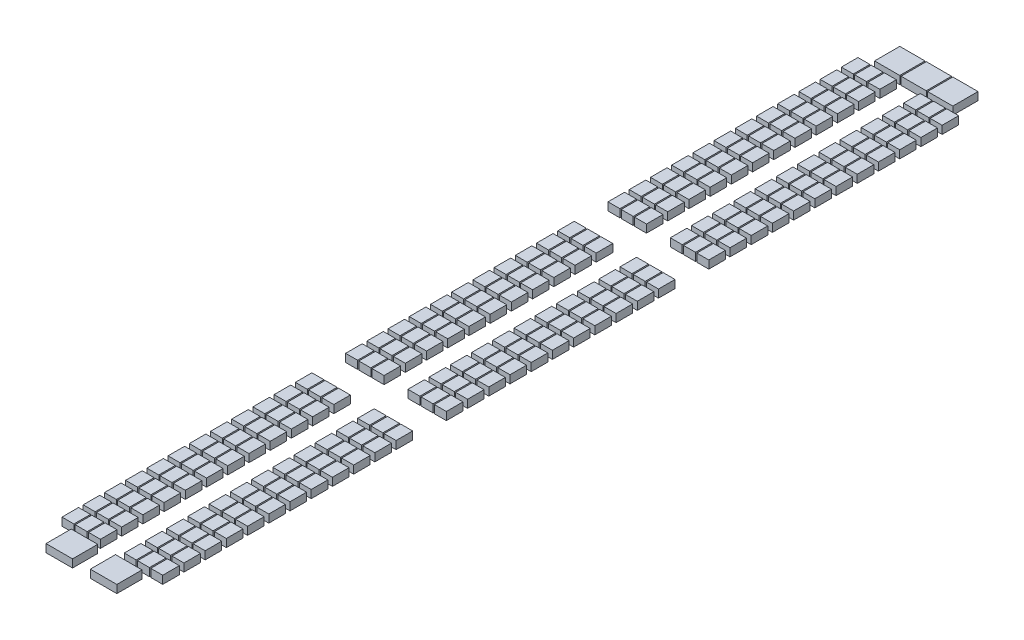
from build123d import *

# Parameters (mm, degrees)
SKETCH1_W           = 457.2
SKETCH1_H           = 635
SKETCH1_W_2         = 1016
SKETCH1_H_2         = 965.2
SKETCH1_W_3         = 965.2
BOSS_EXTRUDE1_DEPTH = 304.8


with BuildPart() as part:
    # Sketch1 → Boss-Extrude1 (new body)
    with BuildSketch(Plane(origin=(0, 0, 0), x_dir=(1, 0, 0), z_dir=(0, 1, 0))):
        with Locations((-1193.292, -14930.966666667)):
            Rectangle(SKETCH1_W, SKETCH1_H)
        with Locations((-1701.292, -14930.966666667)):
            Rectangle(SKETCH1_W, SKETCH1_H)
        with Locations((-685.292, -14930.966666667)):
            Rectangle(SKETCH1_W, SKETCH1_H)
        with Locations((-1193.292, -14118.166666667)):
            Rectangle(SKETCH1_W, SKETCH1_H)
        with Locations((-685.292, -14118.166666667)):
            Rectangle(SKETCH1_W, SKETCH1_H)
        with Locations((-1193.292, -13305.366666667)):
            Rectangle(SKETCH1_W, SKETCH1_H)
        with Locations((-685.292, -13305.366666667)):
            Rectangle(SKETCH1_W, SKETCH1_H)
        with Locations((-1701.292, -14118.166666667)):
            Rectangle(SKETCH1_W, SKETCH1_H)
        with Locations((-1701.292, -13305.366666667)):
            Rectangle(SKETCH1_W, SKETCH1_H)
        with Locations((-1701.292, -12492.566666667)):
            Rectangle(SKETCH1_W, SKETCH1_H)
        with Locations((-1193.292, -12492.566666667)):
            Rectangle(SKETCH1_W, SKETCH1_H)
        with Locations((-685.292, -12492.566666667)):
            Rectangle(SKETCH1_W, SKETCH1_H)
        with Locations((-1701.292, -11679.766666667)):
            Rectangle(SKETCH1_W, SKETCH1_H)
        with Locations((-1193.292, -11679.766666667)):
            Rectangle(SKETCH1_W, SKETCH1_H)
        with Locations((-685.292, -11679.766666667)):
            Rectangle(SKETCH1_W, SKETCH1_H)
        with Locations((-1701.292, -10866.966666667)):
            Rectangle(SKETCH1_W, SKETCH1_H)
        with Locations((-1193.292, -10866.966666667)):
            Rectangle(SKETCH1_W, SKETCH1_H)
        with Locations((-685.292, -10866.966666667)):
            Rectangle(SKETCH1_W, SKETCH1_H)
        with Locations((-1701.292, -10054.166666667)):
            Rectangle(SKETCH1_W, SKETCH1_H)
        with Locations((-1193.292, -10054.166666667)):
            Rectangle(SKETCH1_W, SKETCH1_H)
        with Locations((-685.292, -10054.166666667)):
            Rectangle(SKETCH1_W, SKETCH1_H)
        with Locations((-1701.292, -9241.366666667)):
            Rectangle(SKETCH1_W, SKETCH1_H)
        with Locations((-1193.292, -9241.366666667)):
            Rectangle(SKETCH1_W, SKETCH1_H)
        with Locations((-685.292, -9241.366666667)):
            Rectangle(SKETCH1_W, SKETCH1_H)
        with Locations((-1701.292, -8428.566666667)):
            Rectangle(SKETCH1_W, SKETCH1_H)
        with Locations((-1193.292, -8428.566666667)):
            Rectangle(SKETCH1_W, SKETCH1_H)
        with Locations((-685.292, -8428.566666667)):
            Rectangle(SKETCH1_W, SKETCH1_H)
        with Locations((-1701.292, -7615.766666667)):
            Rectangle(SKETCH1_W, SKETCH1_H)
        with Locations((-1193.292, -7615.766666667)):
            Rectangle(SKETCH1_W, SKETCH1_H)
        with Locations((-685.292, -7615.766666667)):
            Rectangle(SKETCH1_W, SKETCH1_H)
        with Locations((-1701.292, -6802.966666667)):
            Rectangle(SKETCH1_W, SKETCH1_H)
        with Locations((-1193.292, -6802.966666667)):
            Rectangle(SKETCH1_W, SKETCH1_H)
        with Locations((-685.292, -6802.966666667)):
            Rectangle(SKETCH1_W, SKETCH1_H)
        with Locations((-1701.292, -5990.166666667)):
            Rectangle(SKETCH1_W, SKETCH1_H)
        with Locations((-1193.292, -5990.166666667)):
            Rectangle(SKETCH1_W, SKETCH1_H)
        with Locations((-685.292, -5990.166666667)):
            Rectangle(SKETCH1_W, SKETCH1_H)
        with Locations((-1701.292, -4064)):
            Rectangle(SKETCH1_W, SKETCH1_H)
        with Locations((-1193.292, -4064)):
            Rectangle(SKETCH1_W, SKETCH1_H)
        with Locations((-685.292, -4064)):
            Rectangle(SKETCH1_W, SKETCH1_H)
        with Locations((-1193.292, -3251.2)):
            Rectangle(SKETCH1_W, SKETCH1_H)
        with Locations((-685.292, -3251.2)):
            Rectangle(SKETCH1_W, SKETCH1_H)
        with Locations((-1193.292, -2438.4)):
            Rectangle(SKETCH1_W, SKETCH1_H)
        with Locations((-685.292, -2438.4)):
            Rectangle(SKETCH1_W, SKETCH1_H)
        with Locations((-1193.292, -1625.6)):
            Rectangle(SKETCH1_W, SKETCH1_H)
        with Locations((-685.292, -1625.6)):
            Rectangle(SKETCH1_W, SKETCH1_H)
        with Locations((-1193.292, -812.8)):
            Rectangle(SKETCH1_W, SKETCH1_H)
        with Locations((-685.292, -812.8)):
            Rectangle(SKETCH1_W, SKETCH1_H)
        with Locations((-1701.292, -3251.2)):
            Rectangle(SKETCH1_W, SKETCH1_H)
        with Locations((-1701.292, -2438.4)):
            Rectangle(SKETCH1_W, SKETCH1_H)
        with Locations((-1701.292, -1625.6)):
            Rectangle(SKETCH1_W, SKETCH1_H)
        with Locations((-1701.292, -812.8)):
            Rectangle(SKETCH1_W, SKETCH1_H)
        with Locations((-1701.292, 0)):
            Rectangle(SKETCH1_W, SKETCH1_H)
        with Locations((-1193.292, 0)):
            Rectangle(SKETCH1_W, SKETCH1_H)
        with Locations((-685.292, 0)):
            Rectangle(SKETCH1_W, SKETCH1_H)
        with Locations((-1701.292, 812.8)):
            Rectangle(SKETCH1_W, SKETCH1_H)
        with Locations((-1193.292, 812.8)):
            Rectangle(SKETCH1_W, SKETCH1_H)
        with Locations((-685.292, 812.8)):
            Rectangle(SKETCH1_W, SKETCH1_H)
        with Locations((-1701.292, 1625.6)):
            Rectangle(SKETCH1_W, SKETCH1_H)
        with Locations((-1193.292, 1625.6)):
            Rectangle(SKETCH1_W, SKETCH1_H)
        with Locations((-685.292, 1625.6)):
            Rectangle(SKETCH1_W, SKETCH1_H)
        with Locations((-1701.292, 2438.4)):
            Rectangle(SKETCH1_W, SKETCH1_H)
        with Locations((-1193.292, 2438.4)):
            Rectangle(SKETCH1_W, SKETCH1_H)
        with Locations((-685.292, 2438.4)):
            Rectangle(SKETCH1_W, SKETCH1_H)
        with Locations((-1701.292, 3251.2)):
            Rectangle(SKETCH1_W, SKETCH1_H)
        with Locations((-1193.292, 3251.2)):
            Rectangle(SKETCH1_W, SKETCH1_H)
        with Locations((-685.292, 3251.2)):
            Rectangle(SKETCH1_W, SKETCH1_H)
        with Locations((-1701.292, 4064)):
            Rectangle(SKETCH1_W, SKETCH1_H)
        with Locations((-1193.292, 4064)):
            Rectangle(SKETCH1_W, SKETCH1_H)
        with Locations((-685.292, 4064)):
            Rectangle(SKETCH1_W, SKETCH1_H)
        with Locations((-685.292, 14930.966666667)):
            Rectangle(SKETCH1_W, SKETCH1_H)
        with Locations((-1193.292, 14930.966666667)):
            Rectangle(SKETCH1_W, SKETCH1_H)
        with Locations((-1701.292, 14930.966666667)):
            Rectangle(SKETCH1_W, SKETCH1_H)
        with Locations((-685.292, 5990.166666667)):
            Rectangle(SKETCH1_W, SKETCH1_H)
        with Locations((-1193.292, 5990.166666667)):
            Rectangle(SKETCH1_W, SKETCH1_H)
        with Locations((-1701.292, 5990.166666667)):
            Rectangle(SKETCH1_W, SKETCH1_H)
        with Locations((-685.292, 6802.966666667)):
            Rectangle(SKETCH1_W, SKETCH1_H)
        with Locations((-1193.292, 6802.966666667)):
            Rectangle(SKETCH1_W, SKETCH1_H)
        with Locations((-1701.292, 6802.966666667)):
            Rectangle(SKETCH1_W, SKETCH1_H)
        with Locations((-685.292, 7615.766666667)):
            Rectangle(SKETCH1_W, SKETCH1_H)
        with Locations((-1193.292, 7615.766666667)):
            Rectangle(SKETCH1_W, SKETCH1_H)
        with Locations((-1701.292, 7615.766666667)):
            Rectangle(SKETCH1_W, SKETCH1_H)
        with Locations((-685.292, 8428.566666667)):
            Rectangle(SKETCH1_W, SKETCH1_H)
        with Locations((-1193.292, 8428.566666667)):
            Rectangle(SKETCH1_W, SKETCH1_H)
        with Locations((-1701.292, 8428.566666667)):
            Rectangle(SKETCH1_W, SKETCH1_H)
        with Locations((-685.292, 9241.366666667)):
            Rectangle(SKETCH1_W, SKETCH1_H)
        with Locations((-1193.292, 9241.366666667)):
            Rectangle(SKETCH1_W, SKETCH1_H)
        with Locations((-1701.292, 9241.366666667)):
            Rectangle(SKETCH1_W, SKETCH1_H)
        with Locations((-685.292, 10054.166666667)):
            Rectangle(SKETCH1_W, SKETCH1_H)
        with Locations((-1193.292, 10054.166666667)):
            Rectangle(SKETCH1_W, SKETCH1_H)
        with Locations((-1701.292, 10054.166666667)):
            Rectangle(SKETCH1_W, SKETCH1_H)
        with Locations((-685.292, 10866.966666667)):
            Rectangle(SKETCH1_W, SKETCH1_H)
        with Locations((-1193.292, 10866.966666667)):
            Rectangle(SKETCH1_W, SKETCH1_H)
        with Locations((-1701.292, 10866.966666667)):
            Rectangle(SKETCH1_W, SKETCH1_H)
        with Locations((-685.292, 11679.766666667)):
            Rectangle(SKETCH1_W, SKETCH1_H)
        with Locations((-1193.292, 11679.766666667)):
            Rectangle(SKETCH1_W, SKETCH1_H)
        with Locations((-1701.292, 11679.766666667)):
            Rectangle(SKETCH1_W, SKETCH1_H)
        with Locations((-685.292, 12492.566666667)):
            Rectangle(SKETCH1_W, SKETCH1_H)
        with Locations((-1193.292, 12492.566666667)):
            Rectangle(SKETCH1_W, SKETCH1_H)
        with Locations((-1701.292, 12492.566666667)):
            Rectangle(SKETCH1_W, SKETCH1_H)
        with Locations((-1701.292, 13305.366666667)):
            Rectangle(SKETCH1_W, SKETCH1_H)
        with Locations((-1701.292, 14118.166666667)):
            Rectangle(SKETCH1_W, SKETCH1_H)
        with Locations((-685.292, 13305.366666667)):
            Rectangle(SKETCH1_W, SKETCH1_H)
        with Locations((-1193.292, 13305.366666667)):
            Rectangle(SKETCH1_W, SKETCH1_H)
        with Locations((-685.292, 14118.166666667)):
            Rectangle(SKETCH1_W, SKETCH1_H)
        with Locations((-1193.292, 14118.166666667)):
            Rectangle(SKETCH1_W, SKETCH1_H)
        with Locations((1193.292, 14930.966666667)):
            Rectangle(SKETCH1_W, SKETCH1_H)
        with Locations((1701.292, 14930.966666667)):
            Rectangle(SKETCH1_W, SKETCH1_H)
        with Locations((685.292, 14930.966666667)):
            Rectangle(SKETCH1_W, SKETCH1_H)
        with Locations((1193.292, 14118.166666667)):
            Rectangle(SKETCH1_W, SKETCH1_H)
        with Locations((685.292, 14118.166666667)):
            Rectangle(SKETCH1_W, SKETCH1_H)
        with Locations((1193.292, 13305.366666667)):
            Rectangle(SKETCH1_W, SKETCH1_H)
        with Locations((685.292, 13305.366666667)):
            Rectangle(SKETCH1_W, SKETCH1_H)
        with Locations((1701.292, 14118.166666667)):
            Rectangle(SKETCH1_W, SKETCH1_H)
        with Locations((1701.292, 13305.366666667)):
            Rectangle(SKETCH1_W, SKETCH1_H)
        with Locations((1701.292, 12492.566666667)):
            Rectangle(SKETCH1_W, SKETCH1_H)
        with Locations((1193.292, 12492.566666667)):
            Rectangle(SKETCH1_W, SKETCH1_H)
        with Locations((685.292, 12492.566666667)):
            Rectangle(SKETCH1_W, SKETCH1_H)
        with Locations((1701.292, 11679.766666667)):
            Rectangle(SKETCH1_W, SKETCH1_H)
        with Locations((1193.292, 11679.766666667)):
            Rectangle(SKETCH1_W, SKETCH1_H)
        with Locations((685.292, 11679.766666667)):
            Rectangle(SKETCH1_W, SKETCH1_H)
        with Locations((1701.292, 10866.966666667)):
            Rectangle(SKETCH1_W, SKETCH1_H)
        with Locations((1193.292, 10866.966666667)):
            Rectangle(SKETCH1_W, SKETCH1_H)
        with Locations((685.292, 10866.966666667)):
            Rectangle(SKETCH1_W, SKETCH1_H)
        with Locations((1701.292, 10054.166666667)):
            Rectangle(SKETCH1_W, SKETCH1_H)
        with Locations((1193.292, 10054.166666667)):
            Rectangle(SKETCH1_W, SKETCH1_H)
        with Locations((685.292, 10054.166666667)):
            Rectangle(SKETCH1_W, SKETCH1_H)
        with Locations((1701.292, 9241.366666667)):
            Rectangle(SKETCH1_W, SKETCH1_H)
        with Locations((1193.292, 9241.366666667)):
            Rectangle(SKETCH1_W, SKETCH1_H)
        with Locations((685.292, 9241.366666667)):
            Rectangle(SKETCH1_W, SKETCH1_H)
        with Locations((1701.292, 8428.566666667)):
            Rectangle(SKETCH1_W, SKETCH1_H)
        with Locations((1193.292, 8428.566666667)):
            Rectangle(SKETCH1_W, SKETCH1_H)
        with Locations((685.292, 8428.566666667)):
            Rectangle(SKETCH1_W, SKETCH1_H)
        with Locations((1701.292, 7615.766666667)):
            Rectangle(SKETCH1_W, SKETCH1_H)
        with Locations((1193.292, 7615.766666667)):
            Rectangle(SKETCH1_W, SKETCH1_H)
        with Locations((685.292, 7615.766666667)):
            Rectangle(SKETCH1_W, SKETCH1_H)
        with Locations((1701.292, 6802.966666667)):
            Rectangle(SKETCH1_W, SKETCH1_H)
        with Locations((1193.292, 6802.966666667)):
            Rectangle(SKETCH1_W, SKETCH1_H)
        with Locations((685.292, 6802.966666667)):
            Rectangle(SKETCH1_W, SKETCH1_H)
        with Locations((1701.292, 5990.166666667)):
            Rectangle(SKETCH1_W, SKETCH1_H)
        with Locations((1193.292, 5990.166666667)):
            Rectangle(SKETCH1_W, SKETCH1_H)
        with Locations((685.292, 5990.166666667)):
            Rectangle(SKETCH1_W, SKETCH1_H)
        with Locations((685.292, 4064)):
            Rectangle(SKETCH1_W, SKETCH1_H)
        with Locations((1193.292, 4064)):
            Rectangle(SKETCH1_W, SKETCH1_H)
        with Locations((1701.292, 4064)):
            Rectangle(SKETCH1_W, SKETCH1_H)
        with Locations((685.292, 3251.2)):
            Rectangle(SKETCH1_W, SKETCH1_H)
        with Locations((1193.292, 3251.2)):
            Rectangle(SKETCH1_W, SKETCH1_H)
        with Locations((1701.292, 3251.2)):
            Rectangle(SKETCH1_W, SKETCH1_H)
        with Locations((685.292, 2438.4)):
            Rectangle(SKETCH1_W, SKETCH1_H)
        with Locations((1193.292, 2438.4)):
            Rectangle(SKETCH1_W, SKETCH1_H)
        with Locations((1701.292, 2438.4)):
            Rectangle(SKETCH1_W, SKETCH1_H)
        with Locations((685.292, 1625.6)):
            Rectangle(SKETCH1_W, SKETCH1_H)
        with Locations((1193.292, 1625.6)):
            Rectangle(SKETCH1_W, SKETCH1_H)
        with Locations((1701.292, 1625.6)):
            Rectangle(SKETCH1_W, SKETCH1_H)
        with Locations((685.292, 812.8)):
            Rectangle(SKETCH1_W, SKETCH1_H)
        with Locations((1193.292, 812.8)):
            Rectangle(SKETCH1_W, SKETCH1_H)
        with Locations((1701.292, 812.8)):
            Rectangle(SKETCH1_W, SKETCH1_H)
        with Locations((685.292, 0)):
            Rectangle(SKETCH1_W, SKETCH1_H)
        with Locations((1193.292, 0)):
            Rectangle(SKETCH1_W, SKETCH1_H)
        with Locations((1701.292, 0)):
            Rectangle(SKETCH1_W, SKETCH1_H)
        with Locations((1701.292, -812.8)):
            Rectangle(SKETCH1_W, SKETCH1_H)
        with Locations((1701.292, -1625.6)):
            Rectangle(SKETCH1_W, SKETCH1_H)
        with Locations((1701.292, -2438.4)):
            Rectangle(SKETCH1_W, SKETCH1_H)
        with Locations((1701.292, -3251.2)):
            Rectangle(SKETCH1_W, SKETCH1_H)
        with Locations((685.292, -812.8)):
            Rectangle(SKETCH1_W, SKETCH1_H)
        with Locations((1193.292, -812.8)):
            Rectangle(SKETCH1_W, SKETCH1_H)
        with Locations((685.292, -1625.6)):
            Rectangle(SKETCH1_W, SKETCH1_H)
        with Locations((1193.292, -1625.6)):
            Rectangle(SKETCH1_W, SKETCH1_H)
        with Locations((685.292, -2438.4)):
            Rectangle(SKETCH1_W, SKETCH1_H)
        with Locations((1193.292, -2438.4)):
            Rectangle(SKETCH1_W, SKETCH1_H)
        with Locations((685.292, -3251.2)):
            Rectangle(SKETCH1_W, SKETCH1_H)
        with Locations((1193.292, -3251.2)):
            Rectangle(SKETCH1_W, SKETCH1_H)
        with Locations((685.292, -4064)):
            Rectangle(SKETCH1_W, SKETCH1_H)
        with Locations((1193.292, -4064)):
            Rectangle(SKETCH1_W, SKETCH1_H)
        with Locations((1701.292, -4064)):
            Rectangle(SKETCH1_W, SKETCH1_H)
        with Locations((685.292, -5990.166666667)):
            Rectangle(SKETCH1_W, SKETCH1_H)
        with Locations((1193.292, -5990.166666667)):
            Rectangle(SKETCH1_W, SKETCH1_H)
        with Locations((1701.292, -5990.166666667)):
            Rectangle(SKETCH1_W, SKETCH1_H)
        with Locations((685.292, -6802.966666667)):
            Rectangle(SKETCH1_W, SKETCH1_H)
        with Locations((1193.292, -6802.966666667)):
            Rectangle(SKETCH1_W, SKETCH1_H)
        with Locations((1701.292, -6802.966666667)):
            Rectangle(SKETCH1_W, SKETCH1_H)
        with Locations((685.292, -7615.766666667)):
            Rectangle(SKETCH1_W, SKETCH1_H)
        with Locations((1193.292, -7615.766666667)):
            Rectangle(SKETCH1_W, SKETCH1_H)
        with Locations((1701.292, -7615.766666667)):
            Rectangle(SKETCH1_W, SKETCH1_H)
        with Locations((685.292, -8428.566666667)):
            Rectangle(SKETCH1_W, SKETCH1_H)
        with Locations((1193.292, -8428.566666667)):
            Rectangle(SKETCH1_W, SKETCH1_H)
        with Locations((1701.292, -8428.566666667)):
            Rectangle(SKETCH1_W, SKETCH1_H)
        with Locations((685.292, -9241.366666667)):
            Rectangle(SKETCH1_W, SKETCH1_H)
        with Locations((1193.292, -9241.366666667)):
            Rectangle(SKETCH1_W, SKETCH1_H)
        with Locations((1701.292, -9241.366666667)):
            Rectangle(SKETCH1_W, SKETCH1_H)
        with Locations((685.292, -10054.166666667)):
            Rectangle(SKETCH1_W, SKETCH1_H)
        with Locations((1193.292, -10054.166666667)):
            Rectangle(SKETCH1_W, SKETCH1_H)
        with Locations((1701.292, -10054.166666667)):
            Rectangle(SKETCH1_W, SKETCH1_H)
        with Locations((685.292, -10866.966666667)):
            Rectangle(SKETCH1_W, SKETCH1_H)
        with Locations((1193.292, -10866.966666667)):
            Rectangle(SKETCH1_W, SKETCH1_H)
        with Locations((1701.292, -10866.966666667)):
            Rectangle(SKETCH1_W, SKETCH1_H)
        with Locations((685.292, -11679.766666667)):
            Rectangle(SKETCH1_W, SKETCH1_H)
        with Locations((1193.292, -11679.766666667)):
            Rectangle(SKETCH1_W, SKETCH1_H)
        with Locations((1701.292, -11679.766666667)):
            Rectangle(SKETCH1_W, SKETCH1_H)
        with Locations((685.292, -12492.566666667)):
            Rectangle(SKETCH1_W, SKETCH1_H)
        with Locations((1193.292, -12492.566666667)):
            Rectangle(SKETCH1_W, SKETCH1_H)
        with Locations((1701.292, -12492.566666667)):
            Rectangle(SKETCH1_W, SKETCH1_H)
        with Locations((1701.292, -13305.366666667)):
            Rectangle(SKETCH1_W, SKETCH1_H)
        with Locations((1701.292, -14118.166666667)):
            Rectangle(SKETCH1_W, SKETCH1_H)
        with Locations((685.292, -13305.366666667)):
            Rectangle(SKETCH1_W, SKETCH1_H)
        with Locations((1193.292, -13305.366666667)):
            Rectangle(SKETCH1_W, SKETCH1_H)
        with Locations((685.292, -14118.166666667)):
            Rectangle(SKETCH1_W, SKETCH1_H)
        with Locations((1193.292, -14118.166666667)):
            Rectangle(SKETCH1_W, SKETCH1_H)
        with Locations((685.292, -14930.966666667)):
            Rectangle(SKETCH1_W, SKETCH1_H)
        with Locations((1193.292, -14930.966666667)):
            Rectangle(SKETCH1_W, SKETCH1_H)
        with Locations((1701.292, -14930.966666667)):
            Rectangle(SKETCH1_W, SKETCH1_H)
        with Locations((849.026361975, -15951.186153411)):
            Rectangle(SKETCH1_W_2, SKETCH1_H_2)
        with Locations((-849.026361975, -15951.186153411)):
            Rectangle(SKETCH1_W_2, SKETCH1_H_2)
        with Locations((0, 15937.555365643)):
            Rectangle(SKETCH1_W_3, SKETCH1_H_2)
        with Locations((-1016, 15937.555365643)):
            Rectangle(SKETCH1_W_3, SKETCH1_H_2)
        with Locations((1016, 15937.555365643)):
            Rectangle(SKETCH1_W_3, SKETCH1_H_2)
    extrude(amount=BOSS_EXTRUDE1_DEPTH)


solid = part.part
